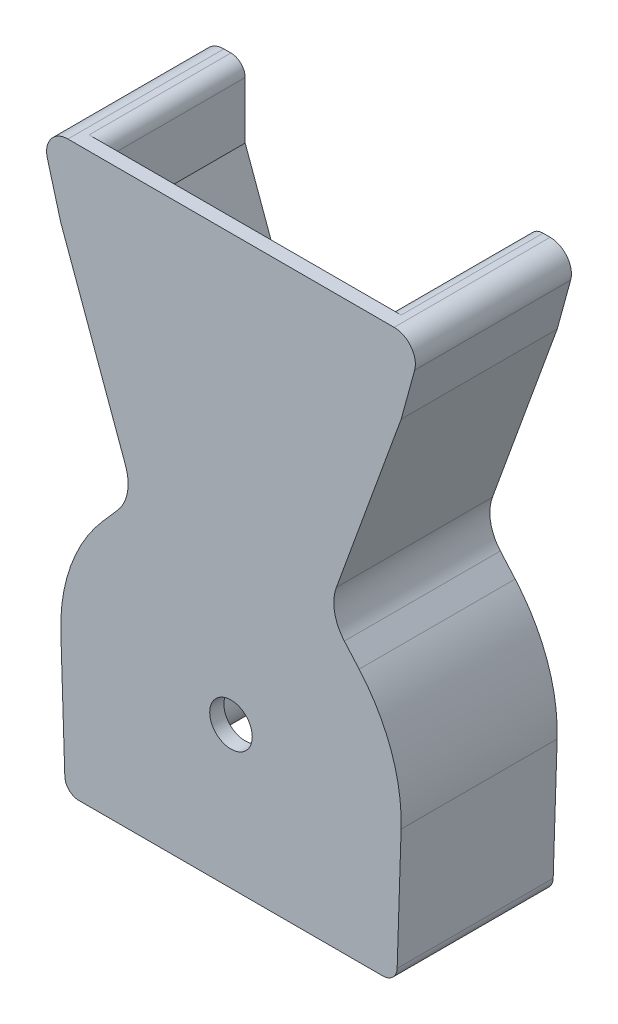
from build123d import *

# Parameters (mm, degrees)
BOSS_EXTRUDE1_DEPTH   = 50
BOSS_EXTRUDE1_2_DEPTH = 50
BOSS_EXTRUDE2_DEPTH   = 10
CHAMFER1_SIZE         = 15
CHAMFER1_SIZE_2       = 20
SKETCH4_W             = 160
SKETCH4_H             = 200
BOSS_EXTRUDE3_DEPTH   = 5
FILLET1_R             = 10
SKETCH5_R             = 7.5
CUT_EXTRUDE1_DEPTH    = 5
CUT_EXTRUDE3_DEPTH    = 55
FILLET3_R             = 15
FILLET4_R             = 5
SKETCH9_R             = 2
CUT_EXTRUDE4_DEPTH    = 10
FILLET6_R             = 5


with BuildPart() as part:
    # Sketch2 → Boss-Extrude1 (new body)
    with BuildSketch(Plane.XY):
        with BuildLine():
            Line((-50, 75), (-22.70223243, 0))
            Line((-22.70223243, 0), (-37.64392369, -17.092022104))
            ThreePointArc((-37.64392369, -17.092022104), (-49.971924127, -51.675350432), (-35.355339059, -85.355339059))
            Line((-35.355339059, -85.355339059), (-50, -100))
            Line((-50, -100), (-80, -100))
            Line((-80, -100), (-80, 100))
            Line((-80, 100), (-50, 100))
            Line((-50, 100), (-50, 75))
        make_face()
    extrude(amount=-BOSS_EXTRUDE1_DEPTH)



with BuildPart() as body_2:
    # Sketch2 → Boss-Extrude1 2 (new body)
    with BuildSketch(Plane.XY):
        with BuildLine():
            Line((50, 75), (22.70223243, 0))
            Line((22.70223243, 0), (37.64392369, -17.092022104))
            ThreePointArc((37.64392369, -17.092022104), (49.971924127, -51.675350432), (35.355339059, -85.355339059))
            Line((35.355339059, -85.355339059), (50, -100))
            Line((50, -100), (80, -100))
            Line((80, -100), (80, 100))
            Line((80, 100), (50, 100))
            Line((50, 100), (50, 75))
        make_face()
    extrude(amount=-BOSS_EXTRUDE1_2_DEPTH)


with BuildPart() as part_1:
    add(part.part)

    add(body_2.part)  # Boss-Extrude2 merges body 2
    # Sketch3 → Boss-Extrude2 (add)
    with BuildSketch(Plane.XY):
        Polygon((-29.981637115, 20), (29.981637115, 20), (22.70223243, 0), (-22.70223243, 0), align=None)
    extrude(amount=-BOSS_EXTRUDE2_DEPTH)

    # Chamfer1
    # the kernel refuses this chamfer: 20, 15 mm, written as the material it takes off along each edge
    with BuildSketch(Plane(origin=(-81.595588718, 20, -10), x_dir=(0, 0.041308380137954244, 0.9991464445867674), z_dir=(1, 0, 0))) as chamfer1_piece_1_section:
        Polygon((CHAMFER1_SIZE * 0.999146444587, CHAMFER1_SIZE * 0.041308380138), (-CHAMFER1_SIZE_2 * 0.041308380138, CHAMFER1_SIZE_2 * 0.999146444587), (0, 0), align=None)
    chamfer1_piece_1 = extrude(amount=163.191177435, mode=Mode.PRIVATE)
    chamfer1_piece_1 = split(chamfer1_piece_1, bisect_by=Plane(origin=(-24.447399798, 4.794807938, -4.975922198), z_dir=(0.9396926207859094, 0.3420201433256661, 0)), keep=Keep.TOP, mode=Mode.PRIVATE)
    chamfer1_piece_1 = split(chamfer1_piece_1, bisect_by=Plane(origin=(24.447399798, 4.794807938, -4.975922198), z_dir=(-0.939692620785907, 0.34202014332567265, 0)), keep=Keep.TOP, mode=Mode.PRIVATE)
    add(chamfer1_piece_1, mode=Mode.SUBTRACT)

    # Sketch4 → Boss-Extrude3 (add)
    with BuildSketch(Plane.XY):
        Rectangle(SKETCH4_W, SKETCH4_H)
    extrude(amount=BOSS_EXTRUDE3_DEPTH)

    # Fillet1
    fillet1_edges = [part_1.edges().sort_by_distance(p)[0] for p in [
        (0, 13.333333333, 0),
        (-22.70223243, 0, -30),
        (-35.355339059, -85.355339059, -25),
        (35.355339059, -85.355339059, -25),
        (22.70223243, 0, -30),
    ]]
    fillet(fillet1_edges, radius=FILLET1_R)

    # Sketch5 → Cut-Extrude1 (cut)
    with BuildSketch(Plane(origin=(0, 0, 0), x_dir=(-1, 0, 0), z_dir=(0, 0, -1))):
        with Locations((0, -50)):
            Circle(SKETCH5_R)
    extrude(amount=-CUT_EXTRUDE1_DEPTH, mode=Mode.SUBTRACT)

    # Sketch8 → Cut-Extrude3 (cut)
    with BuildSketch(Plane(origin=(0, 0, -50), x_dir=(-1, 0, 0), z_dir=(0, 0, -1))):
        with BuildLine():
            Line((-60, 100), (-80, 100))
            Line((-80, 100), (-80, -100))
            Line((-80, -100), (-58.41745651, -100))
            Line((-58.41745651, -100), (-58.898864587, -85.084522946))
            Line((-58.898864587, -85.084522946), (-59.968772691, -51.935536587))
            ThreePointArc((-59.968772691, -51.935536587), (-56.503917554, -29.818144261), (-45.172708428, -10.510426525))
            Line((-45.172708428, -10.510426525), (-34.120235365, 2.132661237))
            Line((-34.120235365, 2.132661237), (-60, 73.236730193))
            Line((-60, 73.236730193), (-64.733567494, 90.51871221))
            ThreePointArc((-64.733567494, 90.51871221), (-63.462787034, 97.049194521), (-57.5, 100))
            Line((-57.5, 100), (-60, 100))
        make_face()
        with BuildLine():
            Line((34.120235365, 2.132661237), (45.172708428, -10.510426525))
            ThreePointArc((45.172708428, -10.510426525), (56.503917554, -29.818144261), (59.968772691, -51.935536587))
            Line((59.968772691, -51.935536587), (58.898864587, -85.084522946))
            Line((58.898864587, -85.084522946), (58.41745651, -100))
            Line((58.41745651, -100), (80, -100))
            Line((80, -100), (80, 100))
            Line((80, 100), (60, 100))
            Line((60, 100), (57.5, 100))
            ThreePointArc((57.5, 100), (63.462787034, 97.049194521), (64.733567494, 90.51871221))
            Line((64.733567494, 90.51871221), (60, 73.236730193))
            Line((60, 73.236730193), (34.120235365, 2.132661237))
        make_face()
    extrude(amount=-CUT_EXTRUDE3_DEPTH, mode=Mode.SUBTRACT)

    # Fillet3
    fillet3_edges = [part_1.edges().sort_by_distance(p)[0] for p in [
        (34.120235365, 2.132661237, -22.5),
        (-34.120235365, 2.132661237, -22.5),
    ]]
    fillet(fillet3_edges, radius=FILLET3_R)

    # Fillet4
    fillet4_edges = [part_1.edges().sort_by_distance(p)[0] for p in [
        (-50, 100, -25),
        (50, 100, -25),
    ]]
    fillet(fillet4_edges, radius=FILLET4_R)

    # Sketch9 → Cut-Extrude4 (cut)
    with BuildSketch(Plane(origin=(0, 0, -50), x_dir=(-1, 0, 0), z_dir=(0, 0, -1))):
        with Locations((-57.5, 92.5)):
            Circle(SKETCH9_R)
        with Locations((-48.939097244, -85.598196118)):
            Circle(SKETCH9_R)
        with Locations(Location((48.939097244, -85.598196118, 0), (0, 0, 180))):
            Circle(SKETCH9_R)
        with Locations(Location((57.5, 92.5, 0), (0, 0, 180))):
            Circle(SKETCH9_R)
    extrude(amount=-CUT_EXTRUDE4_DEPTH, mode=Mode.SUBTRACT)

    # Fillet6
    fillet6_edges = [part_1.edges().sort_by_distance(p)[0] for p in [
        (58.41745651, -100, -22.5),
        (-58.41745651, -100, -22.5),
    ]]
    fillet(fillet6_edges, radius=FILLET6_R)


solid = part_1.part
